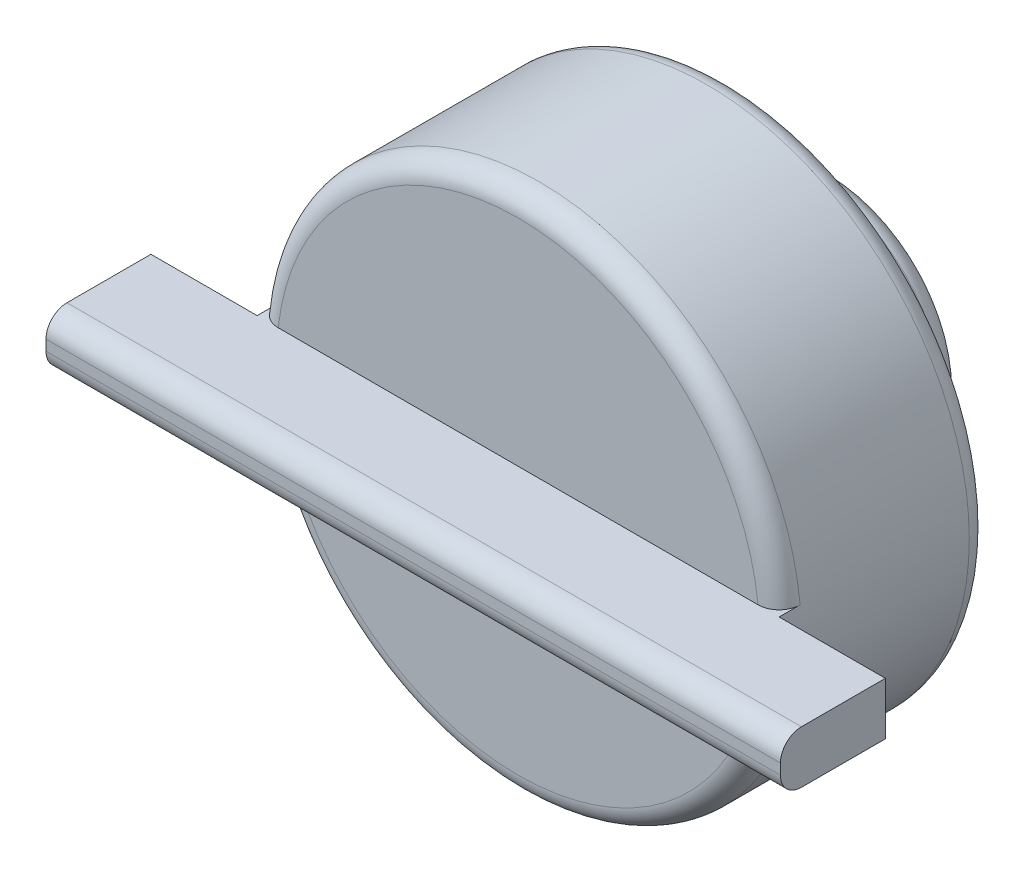
from build123d import *

# Parameters (mm, degrees)
CROQUIS1_R              = 12.5
CROQUIS1_R_2            = 6.5
SALIENTE_EXTRUIR1_DEPTH = 10
CROQUIS2_R              = 25
SALIENTE_EXTRUIR2_DEPTH = 20
CROQUIS3_W              = 70
CROQUIS3_H              = 5
SALIENTE_EXTRUIR3_DEPTH = 10
REDONDEO1_R             = 2


with BuildPart() as part:
    # Croquis1 → Saliente-Extruir1 (new body)
    with BuildSketch(Plane.XY):
        Circle(CROQUIS1_R)
        Circle(CROQUIS1_R_2, mode=Mode.SUBTRACT)
    extrude(amount=SALIENTE_EXTRUIR1_DEPTH)

    # Croquis2 → Saliente-Extruir2 (add)
    with BuildSketch(Plane.XY.offset(10)):
        Circle(CROQUIS2_R)
    extrude(amount=SALIENTE_EXTRUIR2_DEPTH)

    # Croquis3 → Saliente-Extruir3 (add)
    with BuildSketch(Plane.XY.offset(30)):
        Rectangle(CROQUIS3_W, CROQUIS3_H)
    extrude(amount=SALIENTE_EXTRUIR3_DEPTH)

    # Redondeo1
    # the kernel refuses this fillet: 2 mm, written as the material it adds along each edge
    with BuildSketch(Plane(origin=(0, 0, 10), x_dir=(1, 0, 0), z_dir=(0, -1, 0))) as redondeo1_piece_1:
        with BuildLine():
            CenterArc((6.5 - REDONDEO1_R, -REDONDEO1_R), REDONDEO1_R, 0, 90)
            Line((6.5 - REDONDEO1_R, 0), (6.5, 0))
            Line((6.5, 0), (6.5, -REDONDEO1_R))
        make_face()
    revolve(axis=Axis((0, 0, 10), (0, 0, 1)))
    with BuildSketch(Plane(origin=(0, 0, 10), x_dir=(1, 0, 0), z_dir=(0, -1, 0))) as redondeo1_piece_2:
        with BuildLine():
            CenterArc((12.5 + REDONDEO1_R, -REDONDEO1_R), REDONDEO1_R, 90, 90)
            Line((12.5, -REDONDEO1_R), (12.5, 0))
            Line((12.5, 0), (12.5 + REDONDEO1_R, 0))
        make_face()
    revolve(axis=Axis((0, 0, 10), (0, 0, 1)))
    # the kernel refuses this fillet: 2 mm, written as the material it takes off along each edge
    with BuildSketch(Plane(origin=(0, 0, 10), x_dir=(1, 0, 0), z_dir=(0, -1, 0))) as redondeo1_2_piece_1:
        with BuildLine():
            CenterArc((25 - REDONDEO1_R, REDONDEO1_R), REDONDEO1_R, 270, 90)
            Line((25 - REDONDEO1_R, 0), (25, 0))
            Line((25, 0), (25, REDONDEO1_R))
        make_face()
    revolve(axis=Axis((0, 0, 10), (0, 0, 1)), mode=Mode.SUBTRACT)
    with BuildSketch(Plane(origin=(0, 0, 30), x_dir=(0.9949927313637517, -0.09994730878468465, 0), z_dir=(-0.09994730878468465, -0.9949927313637517, 0))) as redondeo1_2_piece_2_section:
        with BuildLine():
            CenterArc((25 - REDONDEO1_R, -REDONDEO1_R), REDONDEO1_R, 0, 90)
            Line((25 - REDONDEO1_R, 0), (25, 0))
            Line((25, 0), (25, -REDONDEO1_R))
        make_face()
    redondeo1_2_piece_2 = revolve(axis=Axis((0, 0, 30), (0, 0, 1)), revolution_arc=191.472272584, mode=Mode.PRIVATE)
    redondeo1_2_piece_2 = split(redondeo1_2_piece_2, bisect_by=Plane(origin=(0, 2.5, 29.442187305), z_dir=(0, 1, 0)), keep=Keep.TOP, mode=Mode.PRIVATE)
    add(redondeo1_2_piece_2, mode=Mode.SUBTRACT)
    with BuildSketch(Plane(origin=(0, 0, 30), x_dir=(-0.9949927313637487, 0.09994730878471461, 0), z_dir=(0.09994730878471461, 0.9949927313637487, 0))) as redondeo1_2_piece_3_section:
        with BuildLine():
            CenterArc((25 - REDONDEO1_R, -REDONDEO1_R), REDONDEO1_R, 0, 90)
            Line((25 - REDONDEO1_R, 0), (25, 0))
            Line((25, 0), (25, -REDONDEO1_R))
        make_face()
    redondeo1_2_piece_3 = revolve(axis=Axis((0, 0, 30), (0, 0, 1)), revolution_arc=191.472272584, mode=Mode.PRIVATE)
    redondeo1_2_piece_3 = split(redondeo1_2_piece_3, bisect_by=Plane(origin=(0, -2.5, 29.442187305), z_dir=(0, -1, 0)), keep=Keep.TOP, mode=Mode.PRIVATE)
    add(redondeo1_2_piece_3, mode=Mode.SUBTRACT)
    with BuildSketch(Plane(origin=(0, 0, 0), x_dir=(1, 0, 0), z_dir=(0, -1, 0))) as redondeo1_2_piece_4:
        with BuildLine():
            CenterArc((12.5 - REDONDEO1_R, REDONDEO1_R), REDONDEO1_R, 270, 90)
            Line((12.5 - REDONDEO1_R, 0), (12.5, 0))
            Line((12.5, 0), (12.5, REDONDEO1_R))
        make_face()
    revolve(axis=Axis((0, 0, 0), (0, 0, 1)), mode=Mode.SUBTRACT)
    with BuildSketch(Plane(origin=(-40, 2.5, 40), x_dir=(0, 0, -1), z_dir=(1, 0, 0)), Plane(origin=(40, -2.5, 40), x_dir=(0, 0, -1), z_dir=(-1, 0, 0))) as redondeo1_2_piece_5:
        with BuildLine():
            CenterArc((REDONDEO1_R, -REDONDEO1_R), REDONDEO1_R, 90, 90)
            Line((0, -REDONDEO1_R), (0, 0))
            Line((0, 0), (REDONDEO1_R, 0))
        make_face()
    extrude(amount=80, mode=Mode.SUBTRACT)


solid = part.part
